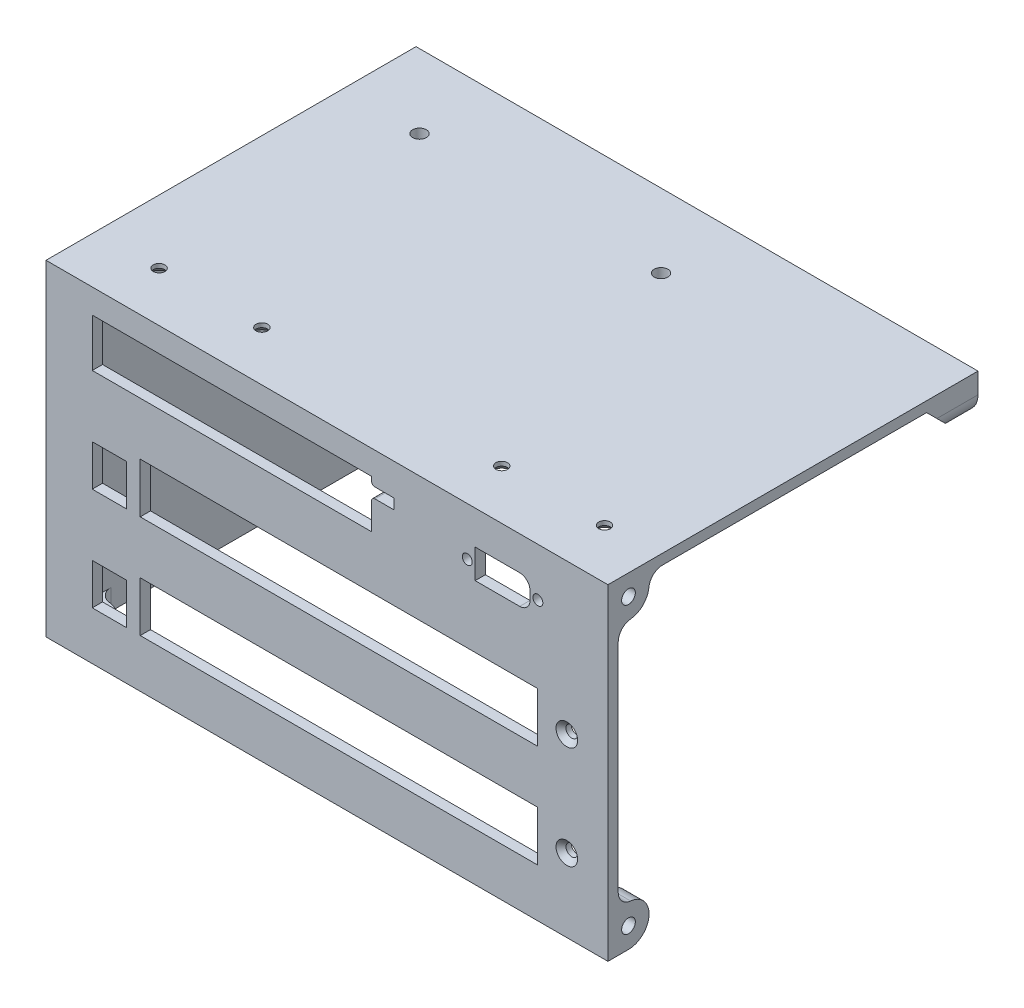
from build123d import *
from build123d.topology import SkipClean

# Parameters (mm, degrees)
SKETCH1_W                                      = 161
SKETCH1_H                                      = 92.2
SKETCH1_W_2                                    = 116
SKETCH1_H_2                                    = 14.6
SKETCH1_W_3                                    = 10
SKETCH1_H_3                                    = 12
BOSS_EXTRUDE1_DEPTH                            = 3
SKETCH4_W                                      = 108
SKETCH4_H                                      = 92.2
BOSS_EXTRUDE2_DEPTH                            = 3
SKETCH5_W                                      = 164
SKETCH5_H                                      = 108
BOSS_EXTRUDE3_DEPTH                            = 3
CSK_FOR_M3_FLAT_HEAD_MACHINE_SCREW1_AT_2_COUNT = 2
CSK_FOR_M3_FLAT_HEAD_MACHINE_SCREW1_AT_2_PITCH = 30
CSK_FOR_M3_FLAT_HEAD_MACHINE_SCREW2_AT_2_COUNT = 2
CSK_FOR_M3_FLAT_HEAD_MACHINE_SCREW2_AT_2_PITCH = 30
CSK_FOR_M3_FLAT_HEAD_MACHINE_SCREW2_AT_3_COUNT = 2
CSK_FOR_M3_FLAT_HEAD_MACHINE_SCREW2_AT_3_PITCH = 78
CSK_FOR_M3_FLAT_HEAD_MACHINE_SCREW2_AT_4_COUNT = 2
CSK_FOR_M3_FLAT_HEAD_MACHINE_SCREW2_AT_4_PITCH = 83.570329663
SKETCH8_R                                      = 6
SKETCH8_R_2                                    = 2
BOSS_EXTRUDE5_DEPTH                            = 6
FILLET2_R                                      = 4
SKETCH10_R                                     = 6
SKETCH10_R_2                                   = 2
BOSS_EXTRUDE6_DEPTH                            = 6
FILLET3_R                                      = 4
SKETCH11_R                                     = 6
SKETCH11_R_2                                   = 2
BOSS_EXTRUDE7_DEPTH                            = 6
FILLET4_R                                      = 4
CHAMFER1_START                                 = -99
CHAMFER1_OUTLINE_R                             = 2
CHAMFER1_DEPTH                                 = 9
CHAMFER1_START_2                               = -30.519406217
CHAMFER1_2_DEPTH                               = 161.519406217
F_4_0MM_DOWEL_HOLE1_D                          = 4
SKETCH14_R                                     = 4
SKETCH14_R_2                                   = 2
BOSS_EXTRUDE8_DEPTH                            = 3
CHAMFER3_SIZE                                  = 3
FILLET5_R                                      = 1
M2_5_CLEARANCE_HOLE1_D                         = 2.9
M2_5_CLEARANCE_HOLE1_DEPTH                     = 5
M2_5_CLEARANCE_HOLE1_TIP                       = 0.871247898
CSK_FOR_M3_SOCKET_COUNTERSUNK_HEAD_S_2_COUNT   = 2
CSK_FOR_M3_SOCKET_COUNTERSUNK_HEAD_S_2_PITCH   = 30
CSK_FOR_M3_SOCKET_COUNTERSUNK_HEAD_S_3_COUNT   = 2
CSK_FOR_M3_SOCKET_COUNTERSUNK_HEAD_S_3_PITCH   = 100
CSK_FOR_M3_SOCKET_COUNTERSUNK_HEAD_S_4_COUNT   = 2
CSK_FOR_M3_SOCKET_COUNTERSUNK_HEAD_S_4_PITCH   = 130
CHAMFER4_SIZE                                  = 2


with BuildPart() as part:
    # Sketch1 → Boss-Extrude1 (new body)
    with BuildSketch(Plane.XY):
        with Locations((49.980593783, 9.1)):
            Rectangle(SKETCH1_W, SKETCH1_H)
        with Locations((51.980593783, -15.6)):
            Rectangle(SKETCH1_W_2, SKETCH1_H_2, mode=Mode.SUBTRACT)
        with Locations((51.980593783, 14.4)):
            Rectangle(SKETCH1_W_2, SKETCH1_H_2, mode=Mode.SUBTRACT)
        Polygon((61.480593783, 51.1), (-20.019406217, 51.1), (-20.019406217, 37.1), (61.480593783, 37.1), (61.480593783, 45.9), (68.080593783, 45.9), (68.080593783, 48.9), (61.480593783, 48.9), align=None, mode=Mode.SUBTRACT)
        with BuildLine():
            Line((104.730593685, 48.35), (91.730593783, 48.35))
            Line((91.730593783, 48.35), (91.730593783, 39.85))
            Line((91.730593783, 39.85), (104.730593685, 39.85))
            ThreePointArc((104.730593685, 39.85), (106.851914092, 40.728679622), (107.730593783, 42.85))
            Line((107.730593783, 42.85), (107.730593783, 45.35))
            ThreePointArc((107.730593783, 45.35), (106.851914092, 47.471320378), (104.730593685, 48.35))
        make_face(mode=Mode.SUBTRACT)
        with Locations((-15.019406217, -16.9)):
            Rectangle(SKETCH1_W_3, SKETCH1_H_3, mode=Mode.SUBTRACT)
        with Locations((-15.019406217, 13.1)):
            Rectangle(SKETCH1_W_3, SKETCH1_H_3, mode=Mode.SUBTRACT)
    extrude(amount=BOSS_EXTRUDE1_DEPTH)

    # Sketch4 → Boss-Extrude2 (add)
    with BuildSketch(Plane.ZY.offset(30.519406217)):
        with Locations((-51, 9.1)):
            Rectangle(SKETCH4_W, SKETCH4_H)
    extrude(amount=BOSS_EXTRUDE2_DEPTH)

    # Sketch5 → Boss-Extrude3 (add)
    with BuildSketch(Plane(origin=(0, 55.2, 0), x_dir=(1, 0, 0), z_dir=(0, 1, 0))):
        with Locations((48.480593783, 51)):
            Rectangle(SKETCH5_W, SKETCH5_H)
    extrude(amount=BOSS_EXTRUDE3_DEPTH)

    # Sketch3 → CSK for M3 Flat Head Machine Screw1 (revolve, cut)
    with BuildSketch(Plane(origin=(118.480593783, 14.4, 3), x_dir=(0, -1, 0), z_dir=(1, 0, 0))):
        Polygon((0, 0), (0, 3), (1.7, 3), (1.7, 1.45), (3.15, 0), align=None)
    csk_for_m3_flat_head_machine_screw1 = revolve(axis=Axis((118.480593783, 14.4, 9.35), (0, 0, -1)), mode=Mode.SUBTRACT)

    # CSK for M3 Flat Head Machine Screw1 at 2: CSK for M3 Flat Head Machine Screw1 ×2
    with Locations(*[(0, -i * CSK_FOR_M3_FLAT_HEAD_MACHINE_SCREW1_AT_2_PITCH, 0) for i in range(1, CSK_FOR_M3_FLAT_HEAD_MACHINE_SCREW1_AT_2_COUNT)]):
        add(csk_for_m3_flat_head_machine_screw1, mode=Mode.SUBTRACT)

    # Sketch7 → CSK for M3 Flat Head Machine Screw2 (revolve, cut)
    with BuildSketch(Plane(origin=(-33.519406217, 14.4, -90), x_dir=(0, 0, 1), z_dir=(0, 1, 0))):
        Polygon((0, 0), (0, 3), (1.7, 3), (1.7, 1.45), (3.15, 0), align=None)
    csk_for_m3_flat_head_machine_screw2 = revolve(axis=Axis((-39.869406217, 14.4, -90), (1, 0, 0)), mode=Mode.SUBTRACT)

    # CSK for M3 Flat Head Machine Screw2 at 2: CSK for M3 Flat Head Machine Screw2 ×2
    with Locations(*[(0, -i * CSK_FOR_M3_FLAT_HEAD_MACHINE_SCREW2_AT_2_PITCH, 0) for i in range(1, CSK_FOR_M3_FLAT_HEAD_MACHINE_SCREW2_AT_2_COUNT)]):
        add(csk_for_m3_flat_head_machine_screw2, mode=Mode.SUBTRACT)

    # CSK for M3 Flat Head Machine Screw2 at 3: CSK for M3 Flat Head Machine Screw2 ×2
    with Locations(*[(0, 0, i * CSK_FOR_M3_FLAT_HEAD_MACHINE_SCREW2_AT_3_PITCH) for i in range(1, CSK_FOR_M3_FLAT_HEAD_MACHINE_SCREW2_AT_3_COUNT)]):
        add(csk_for_m3_flat_head_machine_screw2, mode=Mode.SUBTRACT)

    # CSK for M3 Flat Head Machine Screw2 at 4: CSK for M3 Flat Head Machine Screw2 ×2
    with Locations(*[Vector(0, -0.35897907930886735, 0.9333456062030602) * (i * CSK_FOR_M3_FLAT_HEAD_MACHINE_SCREW2_AT_4_PITCH) for i in range(1, CSK_FOR_M3_FLAT_HEAD_MACHINE_SCREW2_AT_4_COUNT)]):
        add(csk_for_m3_flat_head_machine_screw2, mode=Mode.SUBTRACT)

    # Sketch8 → Boss-Extrude5 (add)
    # profile 1 of 2: a face of its own
    with BuildSketch(Plane.XZ.offset(37)):
        with Locations((-27.519406217, -3)):
            Circle(SKETCH8_R)
        with Locations((-27.519406217, -3)):
            Circle(SKETCH8_R_2, mode=Mode.SUBTRACT)
    # profile 2 of 2: a face of its own
    with BuildSketch(Plane.XZ.offset(37)):
        with BuildLine():
            Line((-27.519406217, -105), (-33.519406217, -105))
            Line((-33.519406217, -105), (-33.519406217, -99))
            ThreePointArc((-33.519406217, -99), (-23.27676553, -94.757359313), (-27.519406217, -105))
        make_face()
        with Locations((-27.519406217, -99)):
            Circle(SKETCH8_R_2, mode=Mode.SUBTRACT)
    extrude(amount=-BOSS_EXTRUDE5_DEPTH)

    # Fillet2
    fillet2_edges = [part.edges().sort_by_distance(p)[0] for p in [
        (-30.519406217, -34, -8.196152423),
        (-22.323253794, -34, 0),
    ]]
    fillet(fillet2_edges, radius=FILLET2_R)

    # Sketch10 → Boss-Extrude6 (add)
    # profile 1 of 2: a face of its own
    with BuildSketch(Plane(origin=(130.480593783, 0, 0), x_dir=(0, 0, -1), z_dir=(1, 0, 0))):
        with Locations((3, 52.2)):
            Circle(SKETCH10_R)
        with Locations((3, 52.2)):
            Circle(SKETCH10_R_2, mode=Mode.SUBTRACT)
    # profile 2 of 2: a face of its own
    with BuildSketch(Plane(origin=(130.480593783, 0, 0), x_dir=(0, 0, -1), z_dir=(1, 0, 0))):
        with BuildLine():
            Line((-3, -31), (-3, -37))
            Line((-3, -37), (3, -37))
            ThreePointArc((3, -37), (7.242640687, -26.757359313), (-3, -31))
        make_face()
        with Locations((3, -31)):
            Circle(SKETCH10_R_2, mode=Mode.SUBTRACT)
    extrude(amount=-BOSS_EXTRUDE6_DEPTH)

    # Fillet3
    fillet3_edges = [part.edges().sort_by_distance(p)[0] for p in [
        (127.480593783, 47.003847577, 0),
        (127.480593783, 55.2, -8.196152423),
        (127.480593783, -25.803847577, 0),
    ]]
    fillet(fillet3_edges, radius=FILLET3_R)

    # Sketch11 → Boss-Extrude7 (add)
    # profile 1 of 2: a face of its own
    with BuildSketch(Plane(origin=(0, 0, -105), x_dir=(-1, 0, 0), z_dir=(0, 0, -1))):
        with Locations((27.519406217, 52.2)):
            Circle(SKETCH11_R)
        with Locations(Location((27.519406217, 52.2, 0), (0, 0, 90))):
            Circle(SKETCH11_R_2, mode=Mode.SUBTRACT)
    # profile 2 of 2: a face of its own
    with BuildSketch(Plane(origin=(0, 0, -105), x_dir=(-1, 0, 0), z_dir=(0, 0, -1))):
        with BuildLine():
            Line((-124.480593783, 58.2), (-130.480593783, 58.2))
            Line((-130.480593783, 58.2), (-130.480593783, 52.2))
            ThreePointArc((-130.480593783, 52.2), (-120.237953096, 47.957359313), (-124.480593783, 58.2))
        make_face()
        with Locations(Location((-124.480593783, 52.2, 0), (0, 0, 90))):
            Circle(SKETCH11_R_2, mode=Mode.SUBTRACT)
    extrude(amount=-BOSS_EXTRUDE7_DEPTH)

    # Fillet4
    fillet4_edges = [part.edges().sort_by_distance(p)[0] for p in [
        (-30.519406217, 47.003847577, -102),
        (-22.323253794, 55.2, -102),
        (119.28444136, 55.2, -102),
    ]]
    fillet(fillet4_edges, radius=FILLET4_R)

    # Chamfer1: read off the stored shape, not the designer's step
    # Chamfer1 outline → Chamfer1 (add)
    # profile 1 of 2: a face of its own
    with SkipClean():  # the faces are left unmerged after this step: merging them gives an invalid solid
        with BuildSketch(Plane.XY.offset(CHAMFER1_START)):
            with BuildLine():
                ThreePointArc((-21.549481594, 51.6), (-20.252813419, 54.166479395), (-17.569531846, 55.2))
                Line((-17.569531846, 55.2), (-30.519406217, 55.2))
                Line((-30.519406217, 55.2), (-30.519406217, 42.250125629))
                ThreePointArc((-30.519406217, 42.250125629), (-29.485885612, 44.933407202), (-26.919406217, 46.230075377))
                ThreePointArc((-26.919406217, 46.230075377), (-23.27676553, 47.957359313), (-21.549481594, 51.6))
            make_face()
            with Locations((-27.519406217, 52.2)):
                Circle(CHAMFER1_OUTLINE_R, mode=Mode.SUBTRACT)
        # profile 2 of 2: a face of its own
        with BuildSketch(Plane.XY.offset(CHAMFER1_START)):
            with BuildLine():
                Line((130.480593783, 52.2), (130.480593783, 55.2))
                Line((130.480593783, 55.2), (114.530719412, 55.2))
                ThreePointArc((114.530719412, 55.2), (117.214000985, 54.166479395), (118.51066916, 51.6))
                ThreePointArc((118.51066916, 51.6), (124.780970433, 46.207523561), (130.480593783, 52.2))
            make_face()
            with Locations((124.480593783, 52.2)):
                Circle(CHAMFER1_OUTLINE_R, mode=Mode.SUBTRACT)
        extrude(amount=CHAMFER1_DEPTH)

    # Chamfer1 2 outline → Chamfer1 2 (cut)
    with SkipClean():  # the faces are left unmerged after this step: merging them gives an invalid solid
        with BuildSketch(Plane.YZ.offset(CHAMFER1_START_2)):
            Polygon((41, -99), (46.2, -99), (55.2, -90), (41, -90), align=None)
        extrude(amount=CHAMFER1_2_DEPTH, mode=Mode.SUBTRACT)
    add(part.part.scale(1), mode=Mode.REPLACE)  # the faces are merged on a copy

    # Chamfer2
    # the kernel refuses this chamfer: 22.12795032, 20 mm, written as the material it adds along each edge
    with BuildSketch(Plane(origin=(-30.519406217, -31, -93.803847577), x_dir=(0, 0, 1), z_dir=(0, -1, 0))) as chamfer2_piece_1:
        with BuildLine():
            Line((7.503584533, 0.600946089), (-1.415463722, -7.646978317))
            Line((-1.415463722, -7.646978317), (-1.742259107, -7.34854365))
            ThreePointArc((-1.742259107, -7.34854365), (0.270050722, -4.002882633), (-0.383267342, -0.221279503))
            Line((-0.383267342, -0.221279503), (0, 0.442559006))
            ThreePointArc((0, 0.442559006), (3.751792267, 0.442559006), (7.503584533, 1.043505096))
            Line((7.503584533, 1.043505096), (7.503584533, 0.600946089))
        make_face()
    extrude(amount=6)

    # Ø4.0mm Dowel Hole1 (through all)
    with Locations(Plane.XZ.offset(-55.2)):
        with Locations((-11.019406217, -83.5), (59.480593783, -83.5)):
            Hole(F_4_0MM_DOWEL_HOLE1_D / 2)

    # Sketch14 → Boss-Extrude8 (add)
    # profile 1 of 6: a face of its own
    with SkipClean():  # the faces are left unmerged after this step: merging them gives an invalid solid
        with BuildSketch(Plane.XZ.offset(-55.2)):
            with Locations(Location((-11.019406217, -83.5, 0), (0, 0, 180))):
                Circle(SKETCH14_R)
            with Locations((-11.019406217, -83.5)):
                Circle(SKETCH14_R_2, mode=Mode.SUBTRACT)
        # profile 2 of 6: a face of its own
        with BuildSketch(Plane.XZ.offset(-55.2)):
            with Locations(Location((59.480593783, -83.5, 0), (0, 0, 180))):
                Circle(SKETCH14_R)
            with Locations((59.480593783, -83.5)):
                Circle(SKETCH14_R_2, mode=Mode.SUBTRACT)
        # profile 3 of 6: a face of its own
        with BuildSketch(Plane.XZ.offset(-55.2)):
            with Locations(Location((80.230593783, -81.5, 0), (0, 0, 180))):
                Circle(SKETCH14_R)
            with Locations((80.230593783, -81.5)):
                Circle(SKETCH14_R_2, mode=Mode.SUBTRACT)
        # profile 4 of 6: a face of its own
        with BuildSketch(Plane.XZ.offset(-55.2)):
            with Locations(Location((119.230593783, -81.5, 0), (0, 0, 180))):
                Circle(SKETCH14_R)
            with Locations((119.230593783, -81.5)):
                Circle(SKETCH14_R_2, mode=Mode.SUBTRACT)
        # profile 5 of 6: a face of its own
        with BuildSketch(Plane.XZ.offset(-55.2)):
            with Locations(Location((80.230593783, -28.5, 0), (0, 0, 180))):
                Circle(SKETCH14_R)
            with Locations((80.230593783, -28.5)):
                Circle(SKETCH14_R_2, mode=Mode.SUBTRACT)
        # profile 6 of 6: a face of its own
        with BuildSketch(Plane.XZ.offset(-55.2)):
            with Locations(Location((119.230593783, -28.5, 0), (0, 0, 180))):
                Circle(SKETCH14_R)
            with Locations((119.230593783, -28.5)):
                Circle(SKETCH14_R_2, mode=Mode.SUBTRACT)
        extrude(amount=BOSS_EXTRUDE8_DEPTH)
    add(part.part.scale(1), mode=Mode.REPLACE)  # the faces are merged on a copy

    # Chamfer3
    chamfer3_edges = [part.edges().sort_by_distance(p)[0] for p in [
        (-7.019406217, 55.2, -83.5),
        (63.480593783, 55.2, -83.5),
        (84.230593783, 55.2, -81.5),
        (123.230593783, 55.2, -81.5),
        (84.230593783, 55.2, -28.5),
        (123.230593783, 55.2, -28.5),
    ]]
    chamfer(chamfer3_edges, length=CHAMFER3_SIZE - 0.0001)  # a hair under: the kernel refuses the full size

    # Fillet5
    fillet5_edges = [part.edges().sort_by_distance(p)[0] for p in [
        (61.480593783, 48.9, 1.5),
        (61.480593783, 45.9, 1.5),
    ]]
    fillet(fillet5_edges, radius=FILLET5_R)

    # M2.5 Clearance Hole1
    with Locations(Plane.XY.offset(3)):
        with Locations((89.430593783, 44.1), (110.030593783, 44.1)):
            Hole(M2_5_CLEARANCE_HOLE1_D / 2, depth=M2_5_CLEARANCE_HOLE1_DEPTH)
            with Locations((0, 0, -(M2_5_CLEARANCE_HOLE1_DEPTH + M2_5_CLEARANCE_HOLE1_TIP / 2))):  # 118° drill point
                Cone(0, M2_5_CLEARANCE_HOLE1_D / 2, M2_5_CLEARANCE_HOLE1_TIP, mode=Mode.SUBTRACT)

    # Sketch21 → CSK for M3 socket countersunk head screw1 (revolve, cut)
    with BuildSketch(Plane(origin=(114.980593783, 55.2, -11.5), x_dir=(0, 0, -1), z_dir=(1, 0, 0))):
        Polygon((0, 0), (0, 3), (1.7, 3), (1.7, 1.77), (3.47, 0), align=None)
    csk_for_m3_socket_countersunk_head_screw = revolve(axis=Axis((114.980593783, 48.85, -11.5), (0, 1, 0)), mode=Mode.SUBTRACT)

    # CSK for M3 socket countersunk head s 2: CSK for M3 socket countersunk head screw1 ×2
    with Locations(*[(-i * CSK_FOR_M3_SOCKET_COUNTERSUNK_HEAD_S_2_PITCH, 0, 0) for i in range(1, CSK_FOR_M3_SOCKET_COUNTERSUNK_HEAD_S_2_COUNT)]):
        add(csk_for_m3_socket_countersunk_head_screw, mode=Mode.SUBTRACT)

    # CSK for M3 socket countersunk head s 3: CSK for M3 socket countersunk head screw1 ×2
    with Locations(*[(-i * CSK_FOR_M3_SOCKET_COUNTERSUNK_HEAD_S_3_PITCH, 0, 0) for i in range(1, CSK_FOR_M3_SOCKET_COUNTERSUNK_HEAD_S_3_COUNT)]):
        add(csk_for_m3_socket_countersunk_head_screw, mode=Mode.SUBTRACT)

    # CSK for M3 socket countersunk head s 4: CSK for M3 socket countersunk head screw1 ×2
    with Locations(*[(-i * CSK_FOR_M3_SOCKET_COUNTERSUNK_HEAD_S_4_PITCH, 0, 0) for i in range(1, CSK_FOR_M3_SOCKET_COUNTERSUNK_HEAD_S_4_COUNT)]):
        add(csk_for_m3_socket_countersunk_head_screw, mode=Mode.SUBTRACT)

    # Chamfer4
    chamfer4_edges = [part.edges().sort_by_distance(p)[0] for p in [
        (-30.519406217, 55.2, -45),
        (46.980593783, 55.2, 0),
        (-30.519406217, 12.1, 0),
    ]]
    chamfer(chamfer4_edges, length=CHAMFER4_SIZE)


solid = part.part
